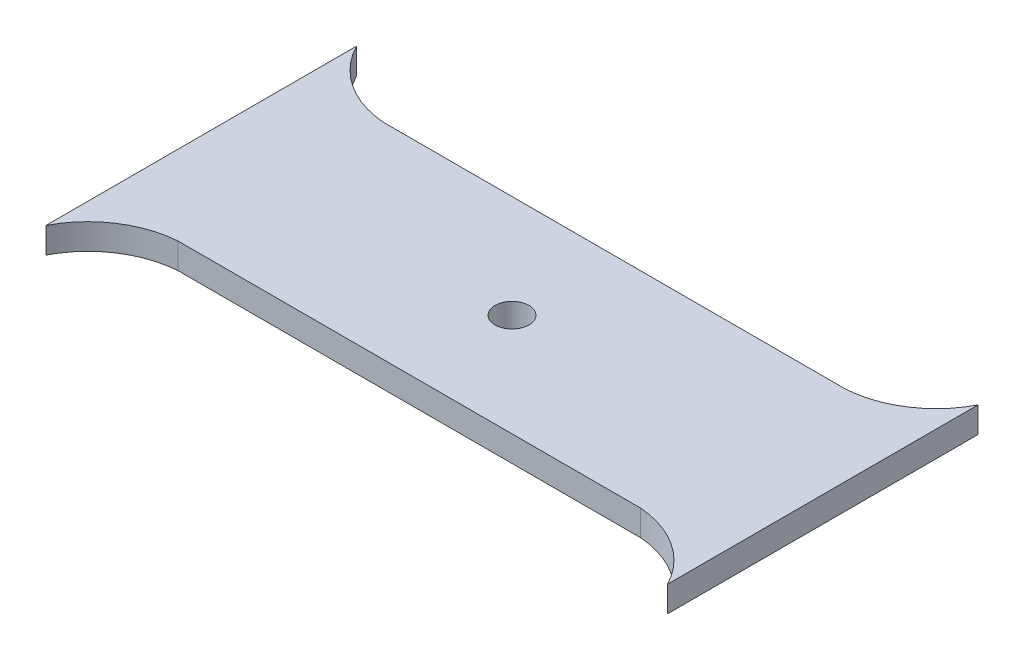
from build123d import *

# Parameters (mm, degrees)
SKETCH1_R           = 4.191
BOSS_EXTRUDE1_DEPTH = 6.35
BOSS_EXTRUDE2_START = 11.43
SKETCH2_R           = 10.16
SKETCH2_R_2         = 4.191
BOSS_EXTRUDE2_DEPTH = 11.43
SKETCH3_R           = 11.43
SKETCH3_R_2         = 10.16
BOSS_EXTRUDE3_DEPTH = 3.175


with BuildPart() as part:
    # Sketch1 → Boss-Extrude1 (new body)
    with BuildSketch(Plane(origin=(0, 0, 0), x_dir=(1, 0, 0), z_dir=(0, 1, 0))):
        with BuildLine():
            ThreePointArc((76.807891903, 38.377582585), (68.670066946, 29.327152907), (57.15, 25.4))
            Line((57.15, 25.4), (-57.15, 25.4))
            ThreePointArc((-57.15, 25.4), (-68.670066946, 29.327152907), (-76.807891903, 38.377582585))
            Line((-76.807891903, 38.377582585), (-76.807891903, -38.377582585))
            ThreePointArc((-76.807891903, -38.377582585), (-68.670066946, -29.327152907), (-57.15, -25.4))
            Line((-57.15, -25.4), (57.15, -25.4))
            ThreePointArc((57.15, -25.4), (68.670066946, -29.327152907), (76.807891903, -38.377582585))
            Line((76.807891903, -38.377582585), (76.807891903, 38.377582585))
        make_face()
        Circle(SKETCH1_R, mode=Mode.SUBTRACT)
    extrude(amount=BOSS_EXTRUDE1_DEPTH)

    # Sketch2 → Boss-Extrude2 (add)
    with BuildSketch(Plane.XZ.offset(BOSS_EXTRUDE2_START)):
        Circle(SKETCH2_R)
        Circle(SKETCH2_R_2, mode=Mode.SUBTRACT)
    extrude(amount=-BOSS_EXTRUDE2_DEPTH)

    # Sketch3 → Boss-Extrude3 (add)
    with BuildSketch(Plane.XZ.offset(11.43)):
        Circle(SKETCH3_R)
        Circle(SKETCH3_R_2, mode=Mode.SUBTRACT)
    extrude(amount=-BOSS_EXTRUDE3_DEPTH)


solid = part.part
